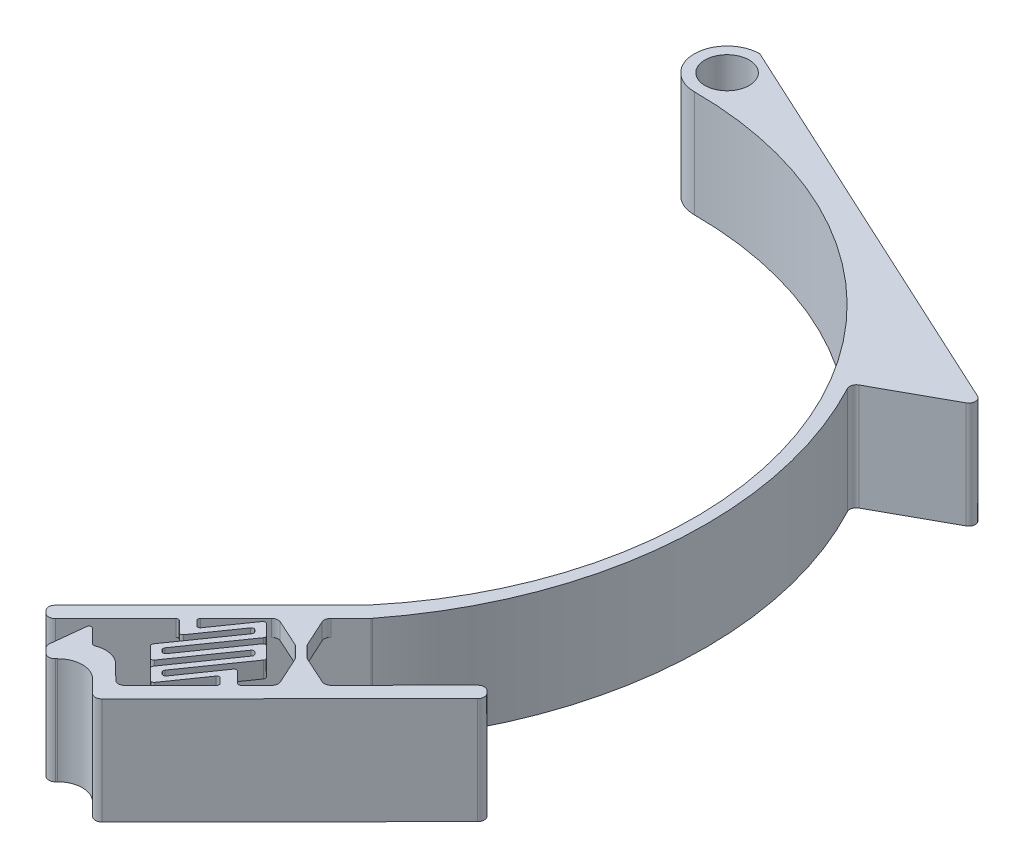
from build123d import *

# Parameters (mm, degrees)
SKETCH1_R           = 2.6999999999999997
BOSS_EXTRUDE1_DEPTH = 13
SKETCH2_W           = 10
SKETCH2_H           = 9
CUT_EXTRUDE1_DEPTH  = 90.94927322415803
FILLET2_R           = 0.8
FILLET4_R           = 3
FILLET5_R           = 3
FILLET6_R           = 0.3
CUT_EXTRUDE2_DEPTH  = 77.54524182212111
FILLET7_R           = 0.3


with BuildPart() as part:
    # Sketch1 → Boss-Extrude1 (new body)
    with BuildSketch(Plane(origin=(0, 0, 0), x_dir=(1, 0, 0), z_dir=(0, 1, 0))):
        with BuildLine():
            Line((50.820681644035226, 29.47855622552854), (0, 52.99999999999999))
            ThreePointArc((-9.3e-16, 52.999999999999986), (-4.000000000000001, 48.999999999999986), (0, 44.999999999999986))
            ThreePointArc((0, 44.99999999999999), (40.783850416649216, 19.017821778331506), (34.47199994035405, -28.925442435894198))
            Line((34.47199994035406, -28.925442435894198), (14.701711021791716, -48.75309171856597))
            Line((14.701711021791716, -48.75309171856597), (16.117971684839706, -50.16525521274901))
            Line((16.117971684839706, -50.16525521274901), (24.237911776392416, -42.02175640022273))
            Line((24.237911776392377, -42.02175640022269), (25.45763253379471, -43.23794856854424))
            Line((25.45763253379471, -43.23794856854423), (24.004584374330243, -45.31952755384914))
            Line((24.004584374330243, -45.31952755384914), (29.270758591293706, -50.57046700111084))
            Line((29.270758591293706, -50.57046700111084), (32.758074174008414, -45.574677436379105))
            Line((32.75807417400839, -45.57467743637909), (33.79050120645215, -46.60411771080363))
            Line((33.79050120645215, -46.60411771080363), (27.4357654826288, -52.9772906945193))
            Line((27.4357654826288, -52.9772906945193), (23.18698349348506, -48.74080021197043))
            Line((23.18698349348506, -48.74080021197043), (21.774819999301435, -50.15706087501902))
            Line((21.77481999930143, -50.15706087501902), (19.508802938424747, -47.89759928432627))
            Line((19.508802938424747, -47.89759928432627), (18.950493010935496, -52.98958220111487))
            Line((18.950493010935496, -52.98958220111487), (20.36675367398342, -54.40174569529783))
            Line((20.36675367398342, -54.40174569529783), (23.191080662350018, -51.569224369201315))
            Line((23.191080662350018, -51.569224369201315), (27.43986265149379, -55.80571485175021))
            Line((27.43986265149379, -55.80571485175021), (51.44664205260424, -31.72928357993548))
            Line((51.44664205260424, -31.72928357993548), (50.03038138955632, -30.317120085752517))
            Line((50.03038138955632, -30.317120085752517), (40.14523693027535, -40.23094472708816))
            Line((40.14523693027537, -40.23094472708818), (36.253592983542276, -38.468813236008195))
            Line((36.253592983542276, -38.468813236008195), (34.83733232049436, -37.056649741825225))
            Line((34.83733232049436, -37.056649741825225), (33.06393361503566, -33.170127256173465))
            Line((33.06393361503564, -33.170127256173444), (35.88826060340199, -30.337605930077157))
            Line((35.88826060340199, -30.337605930077157), (36.00408882659202, -30.211017655267266))
            ThreePointArc((36.00408882659201, -30.21101765526727), (46.25018879499126, -3.9090121285464896), (40.31112943915423, 23.686379393552382))
            Line((40.31112943915425, 23.68637939355239), (50.820681644035226, 29.47855622552854))
        make_face()
        Polygon((33.62990306968709, -44.32573004519616), (35.082951229151554, -42.244151059891266), (29.816777012188087, -36.99321161262956), (26.329461429473383, -41.9890011773613), (25.2970343970296, -40.959560902936744), (30.23960662666981, -36.00264858226921), (34.13125057340287, -37.764780073349186), (35.547511236450795, -39.176943567532156), (37.32090994190943, -43.06346605318404), (34.84962382708942, -45.54192221351771), align=None, mode=Mode.SUBTRACT)
        with Locations(Location((1.8e-15, 48.999999999999986, 0), (0, 0, 90))):
            Circle(SKETCH1_R, mode=Mode.SUBTRACT)
        Polygon((25.766501941183034, -45.66417856365598), (25.12918464281147, -45.02870499127365), (29.778938753097755, -38.367652238297964), (30.416256051469325, -39.00312581068031), align=None, mode=Mode.SUBTRACT)
        Polygon((32.77765265760333, -41.35769101853792), (28.12789854731705, -48.018743771513606), (27.49058124894548, -47.383270199131275), (32.14033535923177, -40.72221744615558), align=None, mode=Mode.SUBTRACT)
        Polygon((31.596954354536326, -40.18040841460911), (26.94720024425004, -46.8414611675848), (26.309882945878474, -46.20598759520245), (30.959637056164762, -39.54493484222678), align=None, mode=Mode.SUBTRACT)
        Polygon((33.95835096067034, -42.53497362246673), (29.30859685038405, -49.19602637544241), (28.671279552012486, -48.56055280306008), (33.321033662298774, -41.89950005008439), align=None, mode=Mode.SUBTRACT)
    extrude(amount=BOSS_EXTRUDE1_DEPTH)

    # Sketch2 → Cut-Extrude1 (cut, through all)
    with BuildSketch(Plane(origin=(-10.69214872852257, 0, 10.723170305734048), x_dir=(0.7081303315239577, 0, 0.7060817470914894), z_dir=(-0.7060817470914894, 0, 0.7081303315239577))):
        with Locations((51.834395676587306, 6.5)):
            Rectangle(SKETCH2_W, SKETCH2_H)
    extrude(amount=-CUT_EXTRUDE1_DEPTH, mode=Mode.SUBTRACT)

    # Fillet2
    fillet2_edges = [part.edges().sort_by_distance(p)[0] for p in [
        (35.547511236450795, 12, 39.176943567532156),
        (34.13125057340287, 12, 37.764780073349186),
        (30.239606626669804, 12, 36.0026485822692),
        (37.32090994190943, 12, 43.06346605318404),
        (50.03038138955632, 6.5, 30.317120085752517),
        (51.44664205260424, 6.5, 31.72928357993548),
        (27.43986265149379, 6.5, 55.80571485175021),
        (20.36675367398342, 6.5, 54.40174569529783),
        (18.950493010935496, 6.5, 52.98958220111487),
        (27.4357654826288, 6.5, 52.9772906945193),
        (16.117971684839706, 6.5, 50.16525521274901),
        (14.701711021791716, 6.5, 48.75309171856597),
        (50.820681644035226, 6.5, -29.47855622552854),
        (40.31112943915424, 6.5, -23.6863793935524),
        (33.06393361503565, 12, 33.17012725617346),
        (34.83733232049436, 12, 37.056649741825225),
        (36.253592983542276, 12, 38.468813236008195),
        (40.14523693027536, 12, 40.23094472708817),
        (33.06393361503565, 1, 33.17012725617346),
        (34.83733232049436, 1, 37.056649741825225),
        (36.253592983542276, 1, 38.468813236008195),
        (40.14523693027536, 1, 40.23094472708817),
        (30.239606626669804, 1, 36.0026485822692),
        (37.32090994190943, 1, 43.06346605318404),
    ]]
    fillet(fillet2_edges, radius=FILLET2_R)

    # Fillet4
    fillet4_edges = [part.edges().sort_by_distance(p)[0] for p in [
        (23.191080662350018, 6.5, 51.569224369201315),
    ]]
    fillet(fillet4_edges, radius=FILLET4_R)

    # Fillet5
    # the kernel refuses this fillet: 3 mm, written as the material it takes off along each edge
    with BuildSketch(Plane(origin=(23.18698349348506, -7.071067811866301, 48.74080021197043), x_dir=(-0.7060817470914842, 0, 0.7081303315239628), z_dir=(0, 1, 0))) as fillet5_piece_1:
        with BuildLine():
            CenterArc((2.999999999999997, 2.828427124746522), FILLET5_R, 180.00000000000003, 70.52877936552818)
            Line((-3.38e-15, 2.8284271247465202), (-0.06000000000000158, 2.8284271247465234))
            Line((-0.06000000000000158, 2.8284271247465234), (-0.05999999999999829, 3.27e-15))
            Line((-0.05999999999999829, 3.27e-15), (-7.6e-16, -0.0600000000000008))
            ThreePointArc((-7.6e-16, -0.0600000000000008), (1.0000000000004632, -0.0599999999999957), (1.9800000000009461, -0.05656854249492852))
            Line((1.9800000000009461, -0.05656854249492852), (2.0000000000009277, 1e-16))
        make_face()
    extrude(amount=27.1421356237326, mode=Mode.SUBTRACT)

    # Fillet6
    fillet6_edges = [part.edges().sort_by_distance(p)[0] for p in [
        (19.508802938424747, 6.5, 47.89759928432627),
        (21.774819999301435, 6.5, 50.15706087501902),
    ]]
    fillet(fillet6_edges, radius=FILLET6_R)

    # Sketch3 → Cut-Extrude2 (cut, through all)
    with BuildSketch(Plane(origin=(0, 13, 0), x_dir=(1, 0, 0), z_dir=(0, 1, 0))):
        Polygon((25.18528267739724, -46.496810157777944), (26.63833083686171, -44.415231172473035), (25.45763253379464, -43.23794856854434), (24.004584374330186, -45.31952755384924), align=None)
        Polygon((26.909361985159702, -48.215901793253224), (27.546679283531265, -48.85137536563556), (28.127898547316995, -48.018743771513705), (27.49058124894543, -47.38327019913137), align=None)
        Polygon((33.90225292608454, -41.06686845596246), (32.449204766620085, -43.14844744126736), (33.629903069687025, -44.32573004519626), (35.08295122915149, -42.24415105989136), align=None)
        Polygon((32.17817361832209, -39.34777682048717), (31.54085631995053, -38.71230324810484), (30.959637056164688, -39.544934842226866), (31.596954354536265, -40.18040841460921), align=None)
    extrude(amount=-CUT_EXTRUDE2_DEPTH, mode=Mode.SUBTRACT)

    # Fillet7
    fillet7_edges = [part.edges().sort_by_distance(p)[0] for p in [
        (25.297034397029616, 12, 40.95956090293676),
        (26.329461429473383, 12, 41.9890011773613),
        (29.816777012188087, 12, 36.99321161262956),
        (34.84962382708942, 12, 45.54192221351771),
        (29.30859685038405, 12, 49.19602637544241),
        (28.671279552012486, 12, 48.56055280306008),
        (32.14033535923177, 12, 40.72221744615558),
        (32.77765265760333, 12, 41.35769101853792),
        (26.309882945878474, 12, 46.20598759520245),
        (26.94720024425004, 12, 46.8414611675848),
        (29.778938753097755, 12, 38.367652238297964),
        (30.416256051469325, 12, 39.00312581068031),
        (33.79050120645215, 12, 46.60411771080363),
        (32.7580741740084, 12, 45.5746774363791),
        (29.270758591293706, 12, 50.57046700111084),
        (24.237911776392394, 12, 42.02175640022271),
        (29.778938753097755, 1, 38.367652238297964),
        (26.309882945878474, 1, 46.20598759520245),
        (32.14033535923177, 1, 40.72221744615558),
        (29.30859685038405, 1, 49.19602637544241),
        (33.79050120645215, 1, 46.60411771080363),
        (32.7580741740084, 1, 45.5746774363791),
        (29.270758591293706, 1, 50.57046700111084),
        (24.237911776392394, 1, 42.02175640022271),
        (30.416256051469325, 1, 39.00312581068031),
        (26.94720024425004, 1, 46.8414611675848),
        (32.77765265760333, 1, 41.35769101853792),
        (28.671279552012486, 1, 48.56055280306008),
        (25.297034397029616, 1, 40.95956090293676),
        (26.329461429473383, 1, 41.9890011773613),
        (29.816777012188087, 1, 36.99321161262956),
        (34.84962382708942, 1, 45.54192221351771),
        (25.18528267739724, 12, 46.496810157777944),
        (25.18528267739724, 1, 46.496810157777944),
        (26.001013538490106, 12, 43.77975760009076),
        (26.001013538490106, 1, 43.77975760009076),
        (27.546679283531265, 12, 48.85137536563556),
        (27.546679283531265, 1, 48.85137536563556),
        (26.909361985159702, 12, 48.215901793253224),
        (26.909361985159702, 1, 48.215901793253224),
        (33.90225292608454, 12, 41.06686845596246),
        (33.90225292608454, 1, 41.06686845596246),
        (33.08652206499161, 12, 43.783921013649746),
        (33.08652206499161, 1, 43.783921013649746),
        (31.54085631995053, 12, 38.71230324810484),
        (31.54085631995053, 1, 38.71230324810484),
        (32.17817361832209, 12, 39.34777682048717),
        (32.17817361832209, 1, 39.34777682048717),
    ]]
    fillet(fillet7_edges, radius=FILLET7_R)


solid = part.part
